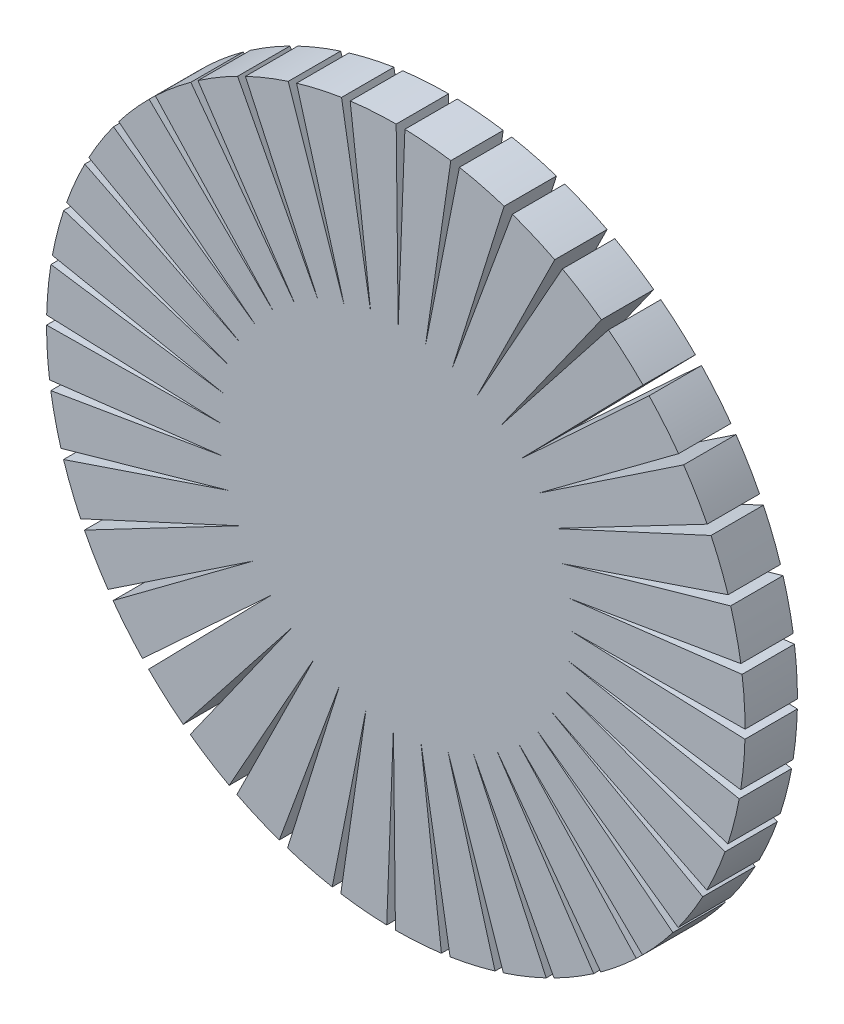
from build123d import *

# Parameters (mm, degrees)
SKETCH1_R           = 20
BOSS_EXTRUDE1_DEPTH = 3
CUT_EXTRUDE5_DEPTH  = 29.442925307
CIRPATTERN1_DEPTH   = 3


# Read off the part's stored shape, not the designer's step: CirPattern1
with BuildPart() as part:
    # Sketch1 → Boss-Extrude1 (new body)
    with BuildSketch(Plane.XY):
        Circle(SKETCH1_R)
    extrude(amount=BOSS_EXTRUDE1_DEPTH)

    # Sketch2 → Cut-Extrude5 (cut, through all)
    with BuildSketch(Plane.XY.offset(3)):
        Polygon((0.021198778, 19.999988765), (0.521152809, 19.993208841), (0.135577303, 9.997518193), align=None)
    extrude(amount=-CUT_EXTRUDE5_DEPTH, mode=Mode.SUBTRACT)


with BuildPart() as cut_extrude5_kept_piece:
    # of the separate pieces the step leaves, the one the design keeps (cut_extrude5_pieces_kept)
    add(part.part.solids().sort_by_distance((20, 0, 0))[0])

    # CirPattern1 outline → CirPattern1 (cut)
    with BuildSketch(Plane.XY):
        with BuildLine():
            Line((-3.107749756, 19.757071931), (-1.430048289, 9.895641117))
            Line((-1.430048289, 9.895641117), (-2.612890376, 19.828585521))
            ThreePointArc((-2.612890376, 19.828585521), (-2.860543555, 19.794375222), (-3.107749756, 19.757071931))
        make_face()
        with BuildLine():
            Line((1.697864531, 9.853223191), (3.642363483, 19.665533006))
            ThreePointArc((3.642363483, 19.665533006), (3.396259749, 19.709526119), (3.149625329, 19.750439499))
            Line((3.149625329, 19.750439499), (1.697864531, 9.853223191))
        make_face()
        with BuildLine():
            Line((3.2183447, 9.466309133), (6.673887081, 18.853626482))
            ThreePointArc((6.673887081, 18.853626482), (6.437695332, 18.935577073), (6.200497654, 19.014568864))
            Line((6.200497654, 19.014568864), (3.2183447, 9.466309133))
        make_face()
        with BuildLine():
            Line((4.659578542, 8.846303128), (9.541077431, 17.577481101))
            ThreePointArc((9.541077431, 17.577481101), (9.320613491, 17.695371275), (9.098693148, 17.810496438))
            Line((9.098693148, 17.810496438), (4.659578542, 8.846303128))
        make_face()
        with BuildLine():
            Line((5.986078095, 8.00847178), (12.17333479, 15.868519799))
            ThreePointArc((12.17333479, 15.868519799), (11.974027213, 16.019446707), (11.772848622, 16.167870479))
            Line((11.772848622, 16.167870479), (5.986078095, 8.00847178))
        make_face()
        with BuildLine():
            Line((7.165180539, 6.973445279), (14.505844245, 13.768822875))
            ThreePointArc((14.505844245, 13.768822875), (14.332600646, 13.949070196), (14.15711749, 14.127137891))
            Line((14.15711749, 14.127137891), (7.165180539, 6.973445279))
        make_face()
        with BuildLine():
            Line((8.167852459, 5.766709411), (16.481171674, 11.330091834))
            ThreePointArc((16.481171674, 11.330091834), (16.338257884, 11.535221282), (16.192791142, 11.73854828))
            Line((16.192791142, 11.73854828), (8.167852459, 5.766709411))
        make_face()
        with BuildLine():
            Line((8.969404743, 4.417978019), (18.050677958, 8.612376328))
            ThreePointArc((18.050677958, 8.612376328), (17.94161299, 8.837336935), (17.829744535, 9.060916653))
            Line((17.829744535, 9.060916653), (8.969404743, 4.417978019))
        make_face()
        with BuildLine():
            Line((9.550100515, 2.960461346), (19.175716644, 5.682595535))
            ThreePointArc((19.175716644, 5.682595535), (19.103186038, 5.921848023), (19.027670443, 6.160175186))
            Line((19.027670443, 6.160175186), (9.550100515, 2.960461346))
        make_face()
        with BuildLine():
            Line((9.895641117, 1.430048289), (19.828585545, 2.612890379))
            ThreePointArc((19.828585545, 2.612890379), (19.794375247, 2.860543558), (19.757071956, 3.10774976))
            Line((19.757071956, 3.10774976), (9.895641117, 1.430048289))
        make_face()
        with BuildLine():
            Line((9.997518193, -0.135577303), (19.993208862, -0.52115281))
            ThreePointArc((19.993208862, -0.52115281), (19.998161242, -0.271196982), (19.999988787, -0.021198778))
            Line((19.999988787, -0.021198778), (9.997518193, -0.135577303))
        make_face()
        with BuildLine():
            Line((9.853223191, -1.697864531), (19.665533023, -3.642363486))
            ThreePointArc((19.665533023, -3.642363486), (19.709526137, -3.396259752), (19.750439517, -3.149625332))
            Line((19.750439517, -3.149625332), (9.853223191, -1.697864531))
        make_face()
        with BuildLine():
            Line((9.466309133, -3.2183447), (18.853626494, -6.673887086))
            ThreePointArc((18.853626494, -6.673887086), (18.935577086, -6.437695337), (19.014568878, -6.200497658))
            Line((19.014568878, -6.200497658), (9.466309133, -3.2183447))
        make_face()
        with BuildLine():
            Line((8.846303128, -4.659578542), (17.577481109, -9.541077435))
            ThreePointArc((17.577481109, -9.541077435), (17.695371283, -9.320613495), (17.810496447, -9.098693153))
            Line((17.810496447, -9.098693153), (8.846303128, -4.659578542))
        make_face()
        with BuildLine():
            Line((8.00847178, -5.986078095), (15.868519802, -12.173334792))
            ThreePointArc((15.868519802, -12.173334792), (16.019446711, -11.974027216), (16.167870483, -11.772848624))
            Line((16.167870483, -11.772848624), (8.00847178, -5.986078095))
        make_face()
        with BuildLine():
            Line((6.973445279, -7.165180539), (13.768822874, -14.505844245))
            ThreePointArc((13.768822874, -14.505844245), (13.949070196, -14.332600646), (14.127137891, -14.15711749))
            Line((14.127137891, -14.15711749), (6.973445279, -7.165180539))
        make_face()
        with BuildLine():
            Line((5.766709411, -8.167852459), (11.330091831, -16.481171669))
            ThreePointArc((11.330091831, -16.481171669), (11.535221279, -16.33825788), (11.738548277, -16.192791138))
            Line((11.738548277, -16.192791138), (5.766709411, -8.167852459))
        make_face()
        with BuildLine():
            Line((4.417978019, -8.969404743), (8.612376324, -18.050677949))
            ThreePointArc((8.612376324, -18.050677949), (8.83733693, -17.941612981), (9.060916649, -17.829744526))
            Line((9.060916649, -17.829744526), (4.417978019, -8.969404743))
        make_face()
        with BuildLine():
            Line((2.960461346, -9.550100515), (5.682595531, -19.17571663))
            ThreePointArc((5.682595531, -19.17571663), (5.921848019, -19.103186025), (6.160175182, -19.02767043))
            Line((6.160175182, -19.02767043), (2.960461346, -9.550100515))
        make_face()
        with BuildLine():
            Line((1.430048289, -9.895641117), (2.612890376, -19.828585527))
            ThreePointArc((2.612890376, -19.828585527), (2.860543556, -19.794375229), (3.107749758, -19.757071938))
            Line((3.107749758, -19.757071938), (1.430048289, -9.895641117))
        make_face()
        with BuildLine():
            Line((-0.135577303, -9.997518193), (-0.521152809, -19.99320884))
            ThreePointArc((-0.521152809, -19.99320884), (-0.271196982, -19.99816122), (-0.021198778, -19.999988765))
            Line((-0.021198778, -19.999988765), (-0.135577303, -9.997518193))
        make_face()
        with BuildLine():
            Line((-1.697864531, -9.853223191), (-3.642363481, -19.665532998))
            ThreePointArc((-3.642363481, -19.665532998), (-3.396259748, -19.709526112), (-3.149625328, -19.750439493))
            Line((-3.149625328, -19.750439493), (-1.697864531, -9.853223191))
        make_face()
        with BuildLine():
            Line((-3.2183447, -9.466309133), (-6.673887077, -18.853626468))
            ThreePointArc((-6.673887077, -18.853626468), (-6.437695328, -18.93557706), (-6.20049765, -19.014568852))
            Line((-6.20049765, -19.014568852), (-3.2183447, -9.466309133))
        make_face()
        with BuildLine():
            Line((-4.659578542, -8.846303128), (-9.541077421, -17.577481083))
            ThreePointArc((-9.541077421, -17.577481083), (-9.320613482, -17.695371257), (-9.098693139, -17.810496421))
            Line((-9.098693139, -17.810496421), (-4.659578542, -8.846303128))
        make_face()
        with BuildLine():
            Line((-5.986078095, -8.00847178), (-12.173334774, -15.868519778))
            ThreePointArc((-12.173334774, -15.868519778), (-11.974027198, -16.019446687), (-11.772848606, -16.167870459))
            Line((-11.772848606, -16.167870459), (-5.986078095, -8.00847178))
        make_face()
        with BuildLine():
            Line((-7.165180539, -6.973445279), (-14.505844222, -13.768822853))
            ThreePointArc((-14.505844222, -13.768822853), (-14.332600623, -13.949070175), (-14.157117468, -14.127137869))
            Line((-14.157117468, -14.127137869), (-7.165180539, -6.973445279))
        make_face()
        with BuildLine():
            Line((-8.167852459, -5.766709411), (-16.481171644, -11.330091814))
            ThreePointArc((-16.481171644, -11.330091814), (-16.338257855, -11.535221261), (-16.192791114, -11.738548259))
            Line((-16.192791114, -11.738548259), (-8.167852459, -5.766709411))
        make_face()
        with BuildLine():
            Line((-8.969404743, -4.417978019), (-18.050677923, -8.612376311))
            ThreePointArc((-18.050677923, -8.612376311), (-17.941612955, -8.837336918), (-17.8297445, -9.060916636))
            Line((-17.8297445, -9.060916636), (-8.969404743, -4.417978019))
        make_face()
        with BuildLine():
            Line((-9.550100515, -2.960461346), (-19.175716604, -5.682595523))
            ThreePointArc((-19.175716604, -5.682595523), (-19.103185999, -5.921848011), (-19.027670404, -6.160175173))
            Line((-19.027670404, -6.160175173), (-9.550100515, -2.960461346))
        make_face()
        with BuildLine():
            Line((-9.895641117, -1.430048289), (-19.828585502, -2.612890373))
            ThreePointArc((-19.828585502, -2.612890373), (-19.794375204, -2.860543552), (-19.757071914, -3.107749754))
            Line((-19.757071914, -3.107749754), (-9.895641117, -1.430048289))
        make_face()
        with BuildLine():
            Line((-9.997518193, 0.135577303), (-19.993208819, 0.521152808))
            ThreePointArc((-19.993208819, 0.521152808), (-19.998161198, 0.271196981), (-19.999988743, 0.021198778))
            Line((-19.999988743, 0.021198778), (-9.997518193, 0.135577303))
        make_face()
        with BuildLine():
            Line((-9.853223191, 1.697864531), (-19.665532981, 3.642363478))
            ThreePointArc((-19.665532981, 3.642363478), (-19.709526095, 3.396259745), (-19.750439475, 3.149625326))
            Line((-19.750439475, 3.149625326), (-9.853223191, 1.697864531))
        make_face()
        with BuildLine():
            Line((-9.466309133, 3.2183447), (-18.853626455, 6.673887072))
            ThreePointArc((-18.853626455, 6.673887072), (-18.935577047, 6.437695323), (-19.014568838, 6.200497646))
            Line((-19.014568838, 6.200497646), (-9.466309133, 3.2183447))
        make_face()
        with BuildLine():
            Line((-8.846303128, 4.659578542), (-17.577481075, 9.541077417))
            ThreePointArc((-17.577481075, 9.541077417), (-17.695371249, 9.320613477), (-17.810496412, 9.098693135))
            Line((-17.810496412, 9.098693135), (-8.846303128, 4.659578542))
        make_face()
        with BuildLine():
            Line((-8.00847178, 5.986078095), (-15.868519775, 12.173334771))
            ThreePointArc((-15.868519775, 12.173334771), (-16.019446683, 11.974027195), (-16.167870455, 11.772848604))
            Line((-16.167870455, 11.772848604), (-8.00847178, 5.986078095))
        make_face()
        with BuildLine():
            Line((-6.973445279, 7.165180539), (-13.768822853, 14.505844223))
            ThreePointArc((-13.768822853, 14.505844223), (-13.949070175, 14.332600624), (-14.127137869, 14.157117468))
            Line((-14.127137869, 14.157117468), (-6.973445279, 7.165180539))
        make_face()
        with BuildLine():
            Line((-5.766709411, 8.167852459), (-11.330091817, 16.481171649))
            ThreePointArc((-11.330091817, 16.481171649), (-11.535221264, 16.338257859), (-11.738548262, 16.192791117))
            Line((-11.738548262, 16.192791117), (-5.766709411, 8.167852459))
        make_face()
        with BuildLine():
            Line((-4.417978019, 8.969404743), (-8.612376316, 18.050677932))
            ThreePointArc((-8.612376316, 18.050677932), (-8.837336922, 17.941612963), (-9.06091664, 17.829744508))
            Line((-9.06091664, 17.829744508), (-4.417978019, 8.969404743))
        make_face()
        with BuildLine():
            Line((-2.960461346, 9.550100515), (-5.682595527, 19.175716618))
            ThreePointArc((-5.682595527, 19.175716618), (-5.921848015, 19.103186012), (-6.160175178, 19.027670417))
            Line((-6.160175178, 19.027670417), (-2.960461346, 9.550100515))
        make_face()
    extrude(amount=CIRPATTERN1_DEPTH, mode=Mode.SUBTRACT)


solid = cut_extrude5_kept_piece.part
